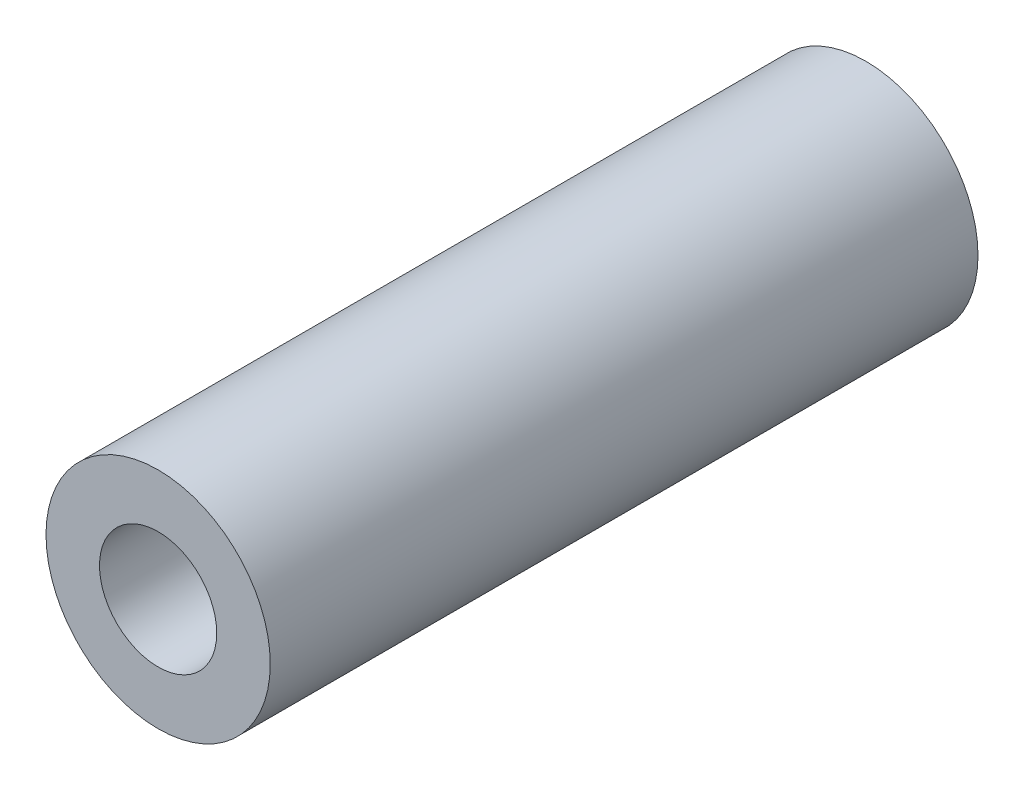
from build123d import *

# Parameters (mm, degrees)
SKETCH1_R           = 4.7625
SKETCH1_R_2         = 2.4892
BOSS_EXTRUDE1_DEPTH = 15.03045


with BuildPart() as part:
    # Sketch1 → Boss-Extrude1 (new, symmetric)
    with BuildSketch(Plane.XY):
        Circle(SKETCH1_R)
        Circle(SKETCH1_R_2, mode=Mode.SUBTRACT)
    extrude(amount=BOSS_EXTRUDE1_DEPTH, both=True)


solid = part.part
